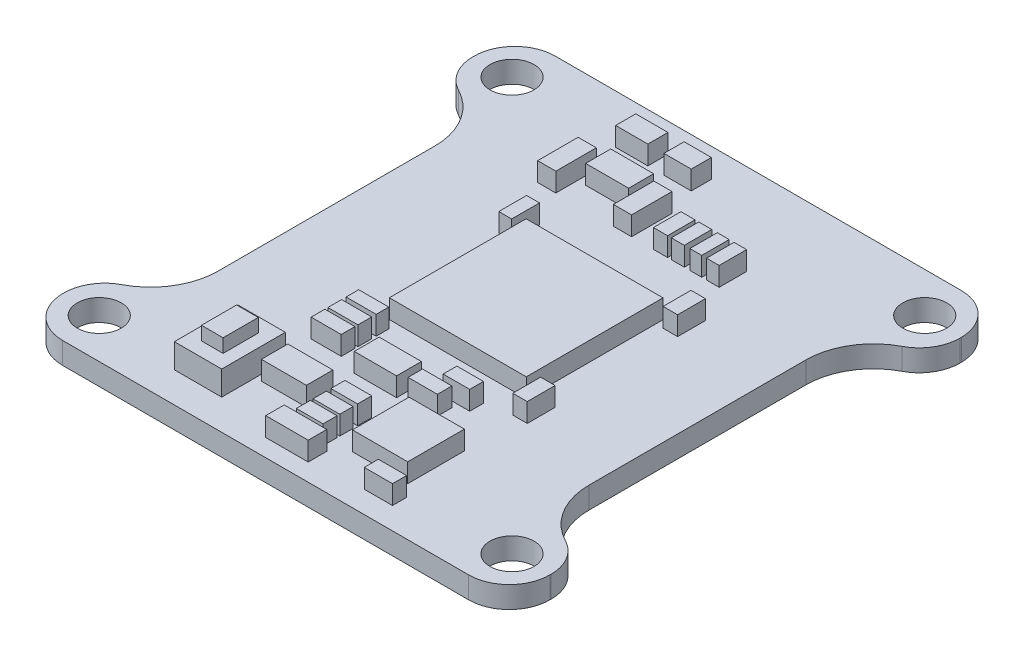
from build123d import *

# Parameters (mm, degrees)
SKETCH1_R             = 1.625
PCB_DEPTH             = 1.6
SKETCH2_W             = 10.119523729
SKETCH2_H             = 10.105815526
SKETCH2_W_2           = 4.08710794
SKETCH2_H_2           = 4.185247137
SKETCH2_W_3           = 3.173060301
SKETCH2_H_3           = 1.850951842
SKETCH2_W_4           = 2.379795226
SKETCH2_H_4           = 1.487372017
SKETCH2_W_5           = 2.0162154
SKETCH2_W_6           = 3.325937142
SKETCH2_H_5           = 1.958029186
SKETCH2_W_7           = 1.344253775
SKETCH2_H_6           = 2.990278807
SKETCH2_W_8           = 1.344253776
SKETCH2_W_9           = 1.04248252
SKETCH2_H_7           = 2.030097539
SKETCH2_W_10          = 0.960181268
SKETCH2_W_11          = 0.877880016
SKETCH2_W_12          = 0.930264892
SKETCH2_W_13          = 1.069916271
SKETCH2_H_8           = 2.057531289
SKETCH2_W_14          = 0.95085214
SKETCH2_W_15          = 2.222133792
SKETCH2_H_9           = 1.01504877
SKETCH2_H_10          = 1.015048769
SKETCH2_H_11          = 0.932747518
SKETCH2_W_16          = 3.127447559
SKETCH2_H_12          = 1.838061285
SKETCH2_W_17          = 2.167266292
SKETCH2_H_13          = 1.06991627
SKETCH2_W_18          = 1.961513162
SKETCH2_H_14          = 2.05753129
SKETCH2_W_19          = 2.08496504
SKETCH2_H_15          = 1.042482519
SKETCH2_W_20          = 3.141164435
SKETCH2_H_16          = 1.371687526
SKETCH2_W_21          = 1.975230037
SKETCH2_H_17          = 0.987615019
SKETCH2_H_18          = 1.04248252
TOP_COMPONENTS_DEPTH  = 1.4
FILLET1_R             = 3
FILLET2_R             = 5
SKETCH3_W             = 3.593796791
SKETCH3_H             = 4.09760008
SKETCH3_H_2           = 1.880865611
SKETCH3_W_2           = 3.038605567
SKETCH3_H_3           = 1.936367939
SKETCH3_W_3           = 3.484639411
SKETCH3_H_4           = 1.923520955
SKETCH3_W_4           = 1.198715958
SKETCH3_H_5           = 2.118660762
SKETCH3_H_6           = 2.118660763
SKETCH3_W_5           = 2.174414993
SKETCH3_H_7           = 1.226593073
SKETCH3_H_8           = 0.842443065
SKETCH3_W_6           = 1.644749802
SKETCH3_H_9           = 3.401008066
SKETCH3_W_7           = 3.819164796
SKETCH3_H_10          = 1.790264985
SKETCH3_W_8           = 1.087207496
SKETCH3_H_11          = 2.146537877
SKETCH3_W_9           = 2.069715113
SKETCH3_H_12          = 1.089323744
SKETCH3_W_10          = 2.026142163
SKETCH3_H_13          = 0.925925182
SKETCH3_W_11          = 2.113288063
SKETCH3_H_14          = 0.991284607
SKETCH3_W_12          = 1.350761442
SKETCH3_H_15          = 3.039213245
SKETCH3_W_13          = 2.004355689
SKETCH3_H_16          = 1.067537269
SKETCH3_W_14          = 3.020546593
SKETCH3_H_17          = 1.432155712
SKETCH3_W_15          = 1.067606985
SKETCH3_H_18          = 2.031057192
SKETCH3_W_16          = 0.911371817
SKETCH3_H_19          = 2.005017997
SKETCH3_W_17          = 1.978978802
SKETCH3_H_20          = 1.054587389
SKETCH3_W_18          = 3.059605385
SKETCH3_H_21          = 1.926900413
SKETCH3_W_19          = 2.010855462
SKETCH3_H_22          = 1.041018093
SKETCH3_W_20          = 2.046445824
SKETCH3_H_23          = 1.058813274
SKETCH3_W_21          = 2.157160771
SKETCH3_H_24          = 1.063389113
SKETCH3_W_22          = 1.093771659
SKETCH3_H_25          = 2.05082186
SKETCH3_W_23          = 1.427979665
SKETCH3_H_26          = 2.430603685
REAR_COMPONENTS_DEPTH = 1.4
SKETCH4_W             = 3.5
SKETCH4_H             = 4.7
BUTTON_BASE_DEPTH     = 1.8
SKETCH5_W             = 1.6
SKETCH5_H             = 2.6
BUTTON_TIP_DEPTH      = 1


with BuildPart() as part:
    # Sketch1 → PCB (new body)
    with BuildSketch(Plane(origin=(0, 0, 0), x_dir=(1, 0, 0), z_dir=(0, 1, 0))):
        Polygon((-18, 18.2), (-18, 12.1), (-13.7, 12.1), (-13.7, -12.1), (-18, -12.1), (-18, -18.2), (18, -18.2), (18, -12.1), (13.7, -12.1), (13.7, 12.1), (18, 12.1), (18, 18.2), align=None)
        with Locations((-15.25, 15.25)):
            Circle(SKETCH1_R, mode=Mode.SUBTRACT)
        with Locations((15.25, 15.25)):
            Circle(SKETCH1_R, mode=Mode.SUBTRACT)
        with Locations((15.25, -15.25)):
            Circle(SKETCH1_R, mode=Mode.SUBTRACT)
        with Locations((-15.25, -15.25)):
            Circle(SKETCH1_R, mode=Mode.SUBTRACT)
    extrude(amount=PCB_DEPTH)

    # Sketch2 → Top components (add)
    with BuildSketch(Plane(origin=(0, 1.6, 0), x_dir=(1, 0, 0), z_dir=(0, 1, 0))):
        with Locations((0.790742833, 0.256899116)):
            Rectangle(SKETCH2_W, SKETCH2_H)
        with Locations((4.865501964, -12.522284706)):
            Rectangle(SKETCH2_W_2, SKETCH2_H_2)
        with Locations((-4.023419024, 11.980078687)):
            Rectangle(SKETCH2_W_3, SKETCH2_H_3)
        with Locations((-5.74216002, 15.334928902)):
            Rectangle(SKETCH2_W_4, SKETCH2_H_4)
        with Locations((-2.354257094, 15.334928902)):
            Rectangle(SKETCH2_W_5, SKETCH2_H_4)
        with Locations((-3.394876095, -12.483901377)):
            Rectangle(SKETCH2_W_6, SKETCH2_H_5)
        with Locations((-6.889989794, 10.95182536)):
            Rectangle(SKETCH2_W_7, SKETCH2_H_6)
        with Locations((-1.293504688, 10.95182536)):
            Rectangle(SKETCH2_W_8, SKETCH2_H_6)
        with Locations((1.51845474, 10.471734726)):
            Rectangle(SKETCH2_W_9, SKETCH2_H_7)
        with Locations((2.79412414, 10.471734726)):
            Rectangle(SKETCH2_W_10, SKETCH2_H_7)
        with Locations((4.12466104, 10.471734726)):
            Rectangle(SKETCH2_W_11, SKETCH2_H_7)
        with Locations((5.385372251, 10.471734726)):
            Rectangle(SKETCH2_W_12, SKETCH2_H_7)
        with Locations((6.936620469, 5.794280262)):
            Rectangle(SKETCH2_W_13, SKETCH2_H_8)
        with Locations((-5.26673395, 5.794280262)):
            Rectangle(SKETCH2_W_14, SKETCH2_H_8)
        with Locations((-4.805024755, -8.416402509)):
            Rectangle(SKETCH2_W_15, SKETCH2_H_9)
        with Locations((-4.805024755, -7.181883736)):
            Rectangle(SKETCH2_W_15, SKETCH2_H_10)
        with Locations((-4.805024755, -5.878780586)):
            Rectangle(SKETCH2_W_15, SKETCH2_H_11)
        with Locations((-0.566510299, -8.608438763)):
            Rectangle(SKETCH2_W_16, SKETCH2_H_12)
        with Locations((2.602087886, -8.663306264)):
            Rectangle(SKETCH2_W_17, SKETCH2_H_13)
        with Locations((3.582844467, -7.181883736)):
            Rectangle(SKETCH2_W_18, SKETCH2_H_10)
        with Locations((6.936620469, -5.3163887)):
            Rectangle(SKETCH2_W_13, SKETCH2_H_14)
        with Locations((6.703433589, -16.05670203)):
            Rectangle(SKETCH2_W_19, SKETCH2_H_15)
        with Locations((0.277077529, -16.221304533)):
            Rectangle(SKETCH2_W_20, SKETCH2_H_16)
        with Locations((0.366237219, -14.794749506)):
            Rectangle(SKETCH2_W_21, SKETCH2_H_15)
        with Locations((0.366237219, -13.587664483)):
            Rectangle(SKETCH2_W_21, SKETCH2_H_17)
        with Locations((0.366237219, -12.243410707)):
            Rectangle(SKETCH2_W_21, SKETCH2_H_18)
    extrude(amount=TOP_COMPONENTS_DEPTH)

    # Fillet1
    fillet1_edges = [part.edges().sort_by_distance(p)[0] for p in [
        (-18, 0.8, 12.1),
        (-18, 0.8, -12.1),
        (18, 0.8, -12.1),
        (18, 0.8, 12.1),
        (18, 0.8, 18.2),
        (-18, 0.8, 18.2),
        (-18, 0.8, -18.2),
        (18, 0.8, -18.2),
    ]]
    fillet(fillet1_edges, radius=FILLET1_R)

    # Fillet2
    fillet2_edges = [part.edges().sort_by_distance(p)[0] for p in [
        (13.7, 0.8, -12.1),
        (13.7, 0.8, 12.1),
        (-13.7, 0.8, 12.1),
        (-13.7, 0.8, -12.1),
    ]]
    fillet(fillet2_edges, radius=FILLET2_R)

    # Sketch3 → Rear components (add)
    with BuildSketch(Plane.XZ):
        with Locations((8.497482131, -12.742908439)):
            Rectangle(SKETCH3_W, SKETCH3_H)
        with Locations((8.497482131, -16.101597029)):
            Rectangle(SKETCH3_W, SKETCH3_H_2)
        with Locations((2.737003728, -14.192980254)):
            Rectangle(SKETCH3_W_2, SKETCH3_H_3)
        with Locations((2.764880844, -11.092196965)):
            Rectangle(SKETCH3_W_3, SKETCH3_H_4)
        with Locations((0.423203159, -13.30842763)):
            Rectangle(SKETCH3_W_4, SKETCH3_H_5)
        with Locations((0.423203159, -15.6222282)):
            Rectangle(SKETCH3_W_4, SKETCH3_H_6)
        with Locations((-1.263362317, -8.959597645)):
            Rectangle(SKETCH3_W_5, SKETCH3_H_7)
        with Locations((-1.263362317, -10.272886867)):
            Rectangle(SKETCH3_W_5, SKETCH3_H_8)
        with Locations((-6.350935857, -1.87881036)):
            Rectangle(SKETCH3_W_6, SKETCH3_H_9)
        with Locations((-6.713338356, -9.798975907)):
            Rectangle(SKETCH3_W_7, SKETCH3_H_10)
        with Locations((7.364604867, 8.393906625)):
            Rectangle(SKETCH3_W_8, SKETCH3_H_11)
        with Locations((5.541800094, -1.652364704)):
            Rectangle(SKETCH3_W_9, SKETCH3_H_12)
        with Locations((5.541800094, -2.790708016)):
            Rectangle(SKETCH3_W_10, SKETCH3_H_13)
        with Locations((5.541800094, -4.010750609)):
            Rectangle(SKETCH3_W_11, SKETCH3_H_14)
        with Locations((3.657270017, -2.714455354)):
            Rectangle(SKETCH3_W_12, SKETCH3_H_15)
        with Locations((0.912174183, -2.534716937)):
            Rectangle(SKETCH3_W_13, SKETCH3_H_16)
        with Locations((-1.814461972, -2.631575246)):
            Rectangle(SKETCH3_W_14, SKETCH3_H_17)
        with Locations((0.854555493, 1.118068801)):
            Rectangle(SKETCH3_W_15, SKETCH3_H_18)
        with Locations((-0.226071091, 1.105049204)):
            Rectangle(SKETCH3_W_16, SKETCH3_H_19)
        with Locations((0.359810792, -0.698165035)):
            Rectangle(SKETCH3_W_17, SKETCH3_H_20)
        with Locations((-2.641206406, 0.167638192)):
            Rectangle(SKETCH3_W_18, SKETCH3_H_21)
        with Locations((-5.090416563, -4.61888001)):
            Rectangle(SKETCH3_W_19, SKETCH3_H_22)
        with Locations((-5.090416563, -5.811157143)):
            Rectangle(SKETCH3_W_20, SKETCH3_H_23)
        with Locations((5.466058947, -16.598741715)):
            Rectangle(SKETCH3_W_21, SKETCH3_H_24)
        with Locations((5.420485128, -14.312455123)):
            Rectangle(SKETCH3_W_22, SKETCH3_H_25)
        with Locations((5.496441493, -11.26660488)):
            Rectangle(SKETCH3_W_23, SKETCH3_H_26)
    extrude(amount=REAR_COMPONENTS_DEPTH)

    # Sketch4 → Button base (add)
    with BuildSketch(Plane(origin=(0, 1.6, 0), x_dir=(1, 0, 0), z_dir=(0, 1, 0))):
        with Locations((-7.25, -13.6)):
            Rectangle(SKETCH4_W, SKETCH4_H)
    extrude(amount=BUTTON_BASE_DEPTH)

    # Sketch5 → Button tip (add)
    with BuildSketch(Plane(origin=(0, 3.4, 0), x_dir=(1, 0, 0), z_dir=(0, 1, 0))):
        with Locations((-7.25, -13.6)):
            Rectangle(SKETCH5_W, SKETCH5_H)
    extrude(amount=BUTTON_TIP_DEPTH)


solid = part.part
